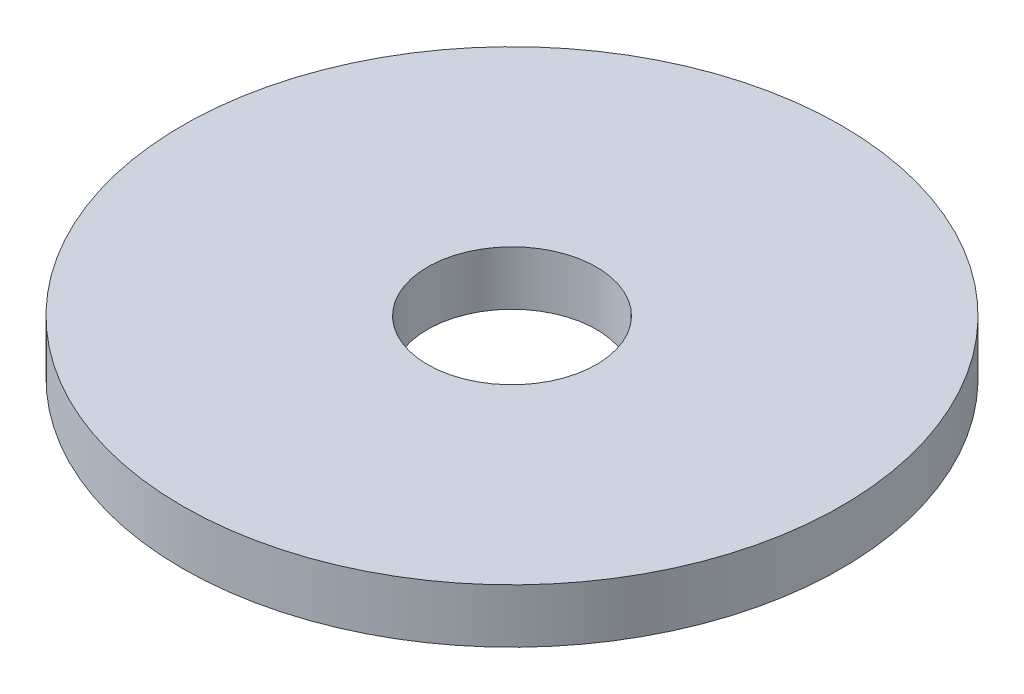
from build123d import *

# Parameters (mm, degrees)
SKETCH1_R           = 97.5
BOSS_EXTRUDE1_DEPTH = 16
SKETCH2_R           = 25
CUT_EXTRUDE1_DEPTH  = 139.811022617


with BuildPart() as part:
    # Sketch1 → Boss-Extrude1 (new body)
    with BuildSketch(Plane(origin=(0, 0, 0), x_dir=(1, 0, 0), z_dir=(0, 1, 0))):
        Circle(SKETCH1_R)
    extrude(amount=BOSS_EXTRUDE1_DEPTH)

    # Sketch2 → Cut-Extrude1 (cut, through all)
    with BuildSketch(Plane(origin=(0, 0, 0), x_dir=(1, 0, 0), z_dir=(0, 1, 0))):
        Circle(SKETCH2_R)
    extrude(amount=CUT_EXTRUDE1_DEPTH, mode=Mode.SUBTRACT)


solid = part.part
